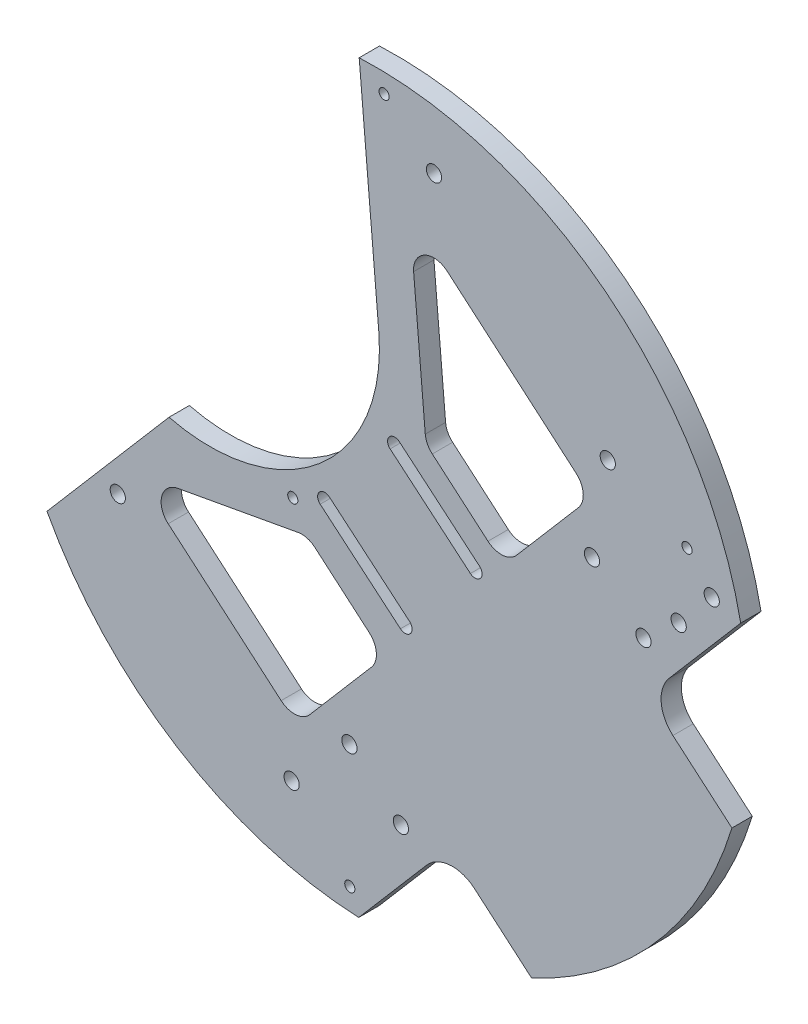
from build123d import *

# Parameters (mm, degrees)
SKETCH1_R                     = 2.25
BOSS_EXTRUDE1_DEPTH           = 6
CUT_EXTRUDE1_DEPTH            = 10
F_4_5_4_5_DIAMETER_HOLE_D     = 4.5
F_4_5_4_5_DIAMETER_HOLE_DEPTH = 10
F_4_5_4_5_DIAMETER_HOLE_TIP   = 1.351936393
F_3_0MM_DOWEL_HOLE1_D         = 3
SKETCH7_R                     = 2.25
CUT_EXTRUDE2_DEPTH            = 10


with BuildPart() as part:
    # Sketch1 → Boss-Extrude1 (new body)
    with BuildSketch(Plane.XY):
        with BuildLine():
            Line((-65.035663921, 1.711915562), (-29.013741643, 43.763540849))
            ThreePointArc((-29.013741643, 43.763540849), (15.528638535, 54.242344342), (32.891210684, 96.578735816))
            Line((32.891210684, 96.578735816), (27.098939814, 163.698257544))
            ThreePointArc((27.098939814, 163.698257544), (127.465162657, -0.583384608), (-65.035663921, 1.711915562))
        make_face()
        with Locations((-44.130722543, 16.588386381)):
            Circle(SKETCH1_R, mode=Mode.SUBTRACT)
        with Locations((7.160790579, -31.047531597)):
            Circle(SKETCH1_R, mode=Mode.SUBTRACT)
        with Locations((100.470270724, 97.551800763)):
            Circle(SKETCH1_R, mode=Mode.SUBTRACT)
        with Locations((49.178757602, 145.187718741)):
            Circle(SKETCH1_R, mode=Mode.SUBTRACT)
    extrude(amount=BOSS_EXTRUDE1_DEPTH)

    # Sketch2 → Cut-Extrude1 (cut)
    with BuildSketch(Plane.XY.offset(6)):
        with BuildLine():
            Line((59.918631336, 48.293162369), (36.232435894, 68.292265986))
            ThreePointArc((36.232435894, 68.292265986), (35.982665158, 71.251592696), (38.941991868, 71.501363433))
            Line((38.941991868, 71.501363433), (62.62818731, 51.502259816))
            ThreePointArc((62.62818731, 51.502259816), (62.877958047, 48.542933105), (59.918631336, 48.293162369))
        make_face()
        with BuildLine():
            Line((39.274395345, 23.842896106), (15.588199903, 43.841999723))
            ThreePointArc((15.588199903, 43.841999723), (15.338429166, 46.801326433), (18.297755877, 47.05109717))
            Line((18.297755877, 47.05109717), (41.983951319, 27.051993553))
            ThreePointArc((41.983951319, 27.051993553), (42.233722055, 24.092666842), (39.274395345, 23.842896106))
        make_face()
    extrude(amount=-CUT_EXTRUDE1_DEPTH, mode=Mode.SUBTRACT)

    # Ø4.5 (4.5) Diameter Hole
    with Locations(Plane(origin=(207.215806152, -96.41995806, 6), x_dir=(-0.6505588840958346, -0.7594558172296677, 0), z_dir=(0, 0, 1))):
        with Locations((80.500098125, -194.461558154), (77.690872648, -264.405165812), (-80.677949684, -277.202176468), (-77.868724207, -207.25856881)):
            Hole(F_4_5_4_5_DIAMETER_HOLE_D / 2, depth=F_4_5_4_5_DIAMETER_HOLE_DEPTH)
            with Locations((0, 0, -(F_4_5_4_5_DIAMETER_HOLE_DEPTH + F_4_5_4_5_DIAMETER_HOLE_TIP / 2))):  # 118° drill point
                Cone(0, F_4_5_4_5_DIAMETER_HOLE_D / 2, F_4_5_4_5_DIAMETER_HOLE_TIP, mode=Mode.SUBTRACT)

    # Ø3.0mm Dowel Hole1 (through all)
    with Locations(Plane(origin=(207.215806152, -96.41995806, 6), x_dir=(-0.6505588840958346, -0.7594558172296677, 0), z_dir=(0, 0, 1))):
        with Locations((-80.915811264, -296.794954316), (-84.945199209, -182.518931257), (25.216324899, -241.36407945), (83.328606401, -169.42446636)):
            Hole(F_3_0MM_DOWEL_HOLE1_D / 2)

    # Sketch7 → Cut-Extrude2 (cut)
    with BuildSketch(Plane.XY.offset(6)):
        with Locations((39.410270698, -26.198883172)):
            Circle(SKETCH7_R)
        with Locations((110.999824953, 57.374033532)):
            Circle(SKETCH7_R)
        with Locations((24.221154353, -13.187705491)):
            Circle(SKETCH7_R)
        with Locations((95.810708608, 70.385211214)):
            Circle(SKETCH7_R)
        with Locations((121.384198104, 66.422365269)):
            Circle(SKETCH7_R)
        with Locations((131.142581365, 77.814202528)):
            Circle(SKETCH7_R)
        with BuildLine():
            Line((43.167555213, 117.068891343), (46.603204237, 77.257369317))
            ThreePointArc((46.603204237, 77.257369317), (47.243256747, 75.033048732), (48.677632994, 73.216504193))
            Line((48.677632994, 73.216504193), (65.110290845, 59.140094069))
            ThreePointArc((65.110290845, 59.140094069), (69.475654709, 57.714643231), (73.570379053, 59.793475668))
            Line((73.570379053, 59.793475668), (91.786027808, 81.05823855))
            ThreePointArc((91.786027808, 81.05823855), (93.211478646, 85.423602414), (91.132646209, 89.518326758))
            Line((91.132646209, 89.518326758), (53.048690579, 122.141496026))
            ThreePointArc((53.048690579, 122.141496026), (46.405146909, 122.922490674), (43.167555213, 117.068891343))
        make_face()
        with BuildLine():
            Line((139.689194778, 75.494313025), (118.594383125, 50.868444691))
            ThreePointArc((118.594383125, 50.868444691), (116.218631729, 43.592838252), (119.683352457, 36.768297678))
            Line((119.683352457, 36.768297678), (137.105326674, 21.84442739))
            Line((137.105326674, 21.84442739), (157.179168696, 45.278426173))
            Line((157.179168696, 45.278426173), (139.689194778, 75.494313025))
        make_face()
        with BuildLine():
            Line((26.971727927, -56.090910074), (47.00482887, -32.704472013))
            ThreePointArc((47.00482887, -32.704472013), (53.829369443, -29.239751286), (61.104975883, -31.615502682))
            Line((61.104975883, -31.615502682), (77.970944185, -46.063091691))
            Line((77.970944185, -46.063091691), (19.420644617, -114.414115242))
            Line((19.420644617, -114.414115242), (26.971727927, -56.090910074))
        make_face()
        with BuildLine():
            Line((30.087133776, 18.254417116), (14.029920525, 32.009216931))
            ThreePointArc((14.029920525, 32.009216931), (11.691810194, 33.244719457), (9.049641572, 33.355043433))
            Line((9.049641572, 33.355043433), (-26.43283022, 26.881246492))
            ThreePointArc((-26.43283022, 26.881246492), (-31.148141999, 22.54392806), (-29.259257875, 16.421950183))
            Line((-29.259257875, 16.421950183), (4.064778412, -12.123815573))
            ThreePointArc((4.064778412, -12.123815573), (8.430142276, -13.549266411), (12.52486662, -11.470433974))
            Line((12.52486662, -11.470433974), (30.740515375, 9.794328908))
            ThreePointArc((30.740515375, 9.794328908), (32.165966213, 14.159692772), (30.087133776, 18.254417116))
        make_face()
    extrude(amount=-CUT_EXTRUDE2_DEPTH, mode=Mode.SUBTRACT)


solid = part.part
